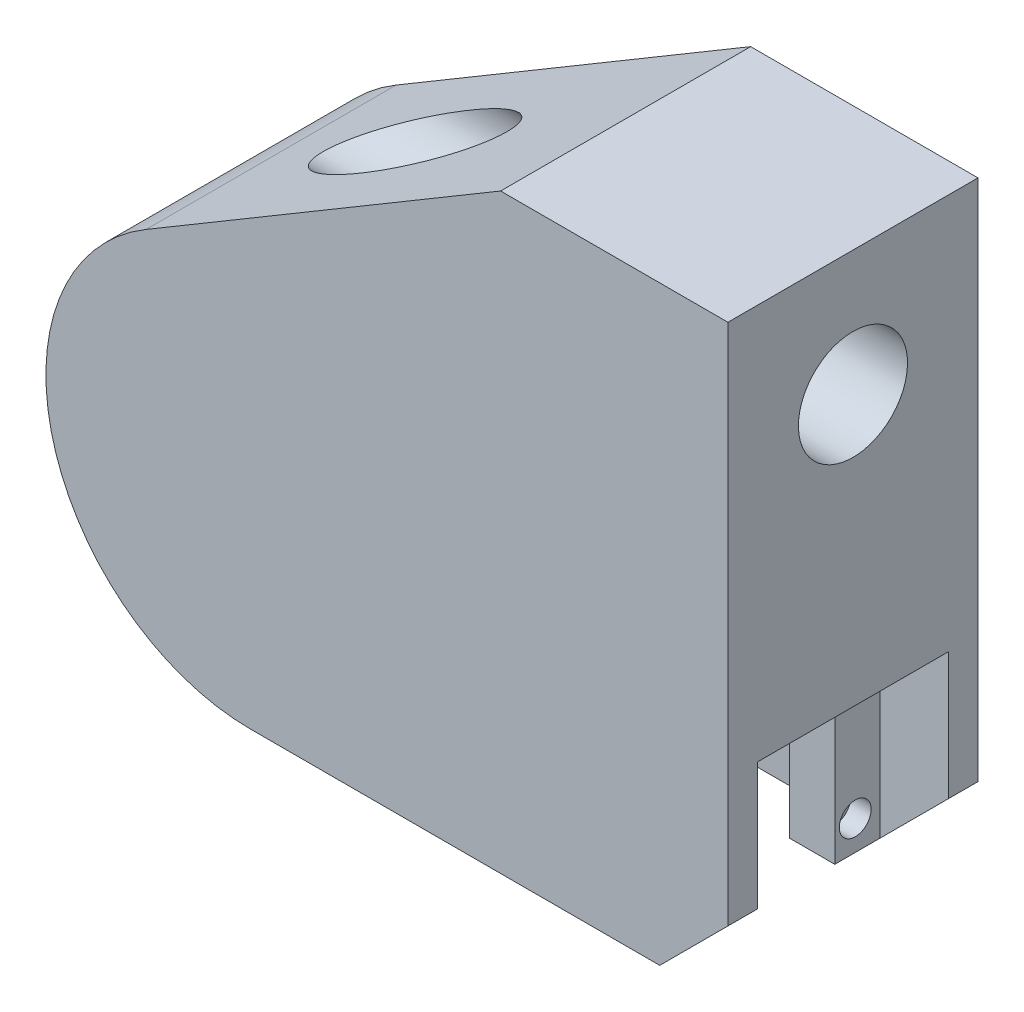
from build123d import *

# Parameters (mm, degrees)
AUFSATZ_LINEAR_AUSTRAGEN2_DEPTH = 55
SCHNITT_LINEAR_AUSTRAGEN1_DEPTH = 43
SKIZZE4_R                       = 1.5
SCHNITT_LINEAR_AUSTRAGEN2_DEPTH = 10
SKIZZE5_R                       = 3.5
SCHNITT_LINEAR_AUSTRAGEN3_DEPTH = 4.5
SCHNITT_LINEAR_AUSTRAGEN4_DEPTH = 7
SCHNITT_LINEAR_START            = -6
SKIZZE7_R                       = 10
SCHNITT_LINEAR_AUSTRAGEN5_DEPTH = 49
SKIZZE8_R                       = 12
SCHNITT_LINEAR_AUSTRAGEN6_DEPTH = 181.969610709
SKIZZE9_R                       = 1.65
SCHNITT_LINEAR_AUSTRAGEN9_DEPTH = 20
FASE1_SIZE                      = 15


with BuildPart() as part:
    # Skizze1 → Aufsatz-Linear austragen2 (new body)
    with BuildSketch(Plane.XY):
        with BuildLine():
            Line((105, -45), (105, 85))
            Line((105, 85), (55, 85))
            Line((55, 85), (-22.977666384, 38.69143119))
            ThreePointArc((-22.977666384, 38.69143119), (-43.394207007, -11.913974913), (0, -45))
            Line((0, -45), (105, -45))
        make_face()
    extrude(amount=AUFSATZ_LINEAR_AUSTRAGEN2_DEPTH)

    # Skizze3 → Schnitt-Linear austragen1 (cut)
    with BuildSketch(Plane.XZ.offset(45)):
        Polygon((80, 48.5), (19, 48.5), (19, 6.5), (80, 6.5), (80, 16.5), (90, 16.5), (90, 6.5), (105, 6.5), (105, 48.5), (90, 48.5), (90, 38.5), (80, 38.5), align=None)
    extrude(amount=-SCHNITT_LINEAR_AUSTRAGEN1_DEPTH, mode=Mode.SUBTRACT)

    # Skizze4 → Schnitt-Linear austragen2 (cut)
    with BuildSketch(Plane(origin=(90, 0, 0), x_dir=(0, 0, -1), z_dir=(1, 0, 0))):
        with Locations((-42.999780644, -7.500219356)):
            Circle(SKIZZE4_R)
        with Locations((-12.000219356, -7.500219356)):
            Circle(SKIZZE4_R)
        with Locations((-42.999780644, -38.499780644)):
            Circle(SKIZZE4_R)
        with Locations((-12.000219356, -38.499780644)):
            Circle(SKIZZE4_R)
    extrude(amount=-SCHNITT_LINEAR_AUSTRAGEN2_DEPTH, mode=Mode.SUBTRACT)

    # Skizze5 → Schnitt-Linear austragen3 (cut)
    with BuildSketch(Plane(origin=(90, 0, 0), x_dir=(0, 0, -1), z_dir=(1, 0, 0))):
        with Locations((-42.999780644, -7.500219356)):
            Circle(SKIZZE5_R)
        with Locations((-12.000219356, -7.500219356)):
            Circle(SKIZZE5_R)
        with Locations((-12.000219356, -38.499780644)):
            Circle(SKIZZE5_R)
        with Locations((-42.999780644, -38.499780644)):
            Circle(SKIZZE5_R)
    extrude(amount=-SCHNITT_LINEAR_AUSTRAGEN3_DEPTH, mode=Mode.SUBTRACT)

    # Skizze6 → Schnitt-Linear austragen4 (cut, symmetric)
    with BuildSketch(Plane.XY.offset(27.5)):
        with BuildLine():
            Line((9.682458366, 2.5), (19, 2.5))
            Line((19, 2.5), (19, -2))
            Line((19, -2), (29, -2))
            Line((29, -2), (29, 10))
            Line((29, 10), (0, 10))
            ThreePointArc((0, 10), (6.123724357, 7.90569415), (9.682458366, 2.5))
        make_face()
    extrude(amount=SCHNITT_LINEAR_AUSTRAGEN4_DEPTH, both=True, mode=Mode.SUBTRACT)

    # Skizze7 → Schnitt-Linear austragen5 (cut)
    with BuildSketch(Plane.XY.offset(55).offset(SCHNITT_LINEAR_START)):
        Circle(SKIZZE7_R)
    extrude(amount=-SCHNITT_LINEAR_AUSTRAGEN5_DEPTH, mode=Mode.SUBTRACT)

    # Skizze8 → Schnitt-Linear austragen6 (cut, through all)
    with BuildSketch(Plane(origin=(105, 0, 0), x_dir=(0, 0, -1), z_dir=(1, 0, 0))):
        with Locations((-27.5, 57.5)):
            Circle(SKIZZE8_R)
    extrude(amount=-SCHNITT_LINEAR_AUSTRAGEN6_DEPTH, mode=Mode.SUBTRACT)

    # Skizze9 → Schnitt-Linear austragen9 (cut)
    with BuildSketch(Plane(origin=(0, 0, 0), x_dir=(-1, 0, 0), z_dir=(0, 0, -1))):
        with Locations((-3.374265815, 14.615550972)):
            Circle(SKIZZE9_R)
        with Locations((-14.615550972, -3.374265815)):
            Circle(SKIZZE9_R)
        with Locations((14.615550972, 3.374265815)):
            Circle(SKIZZE9_R)
        with Locations((3.374265815, -14.615550972)):
            Circle(SKIZZE9_R)
    extrude(amount=-SCHNITT_LINEAR_AUSTRAGEN9_DEPTH, mode=Mode.SUBTRACT)

    # Fase1
    fase1_edges = [part.edges().sort_by_distance(p)[0] for p in [
        (105, -45, 51.75),
        (105, -45, 3.25),
    ]]
    chamfer(fase1_edges, length=FASE1_SIZE)


solid = part.part
